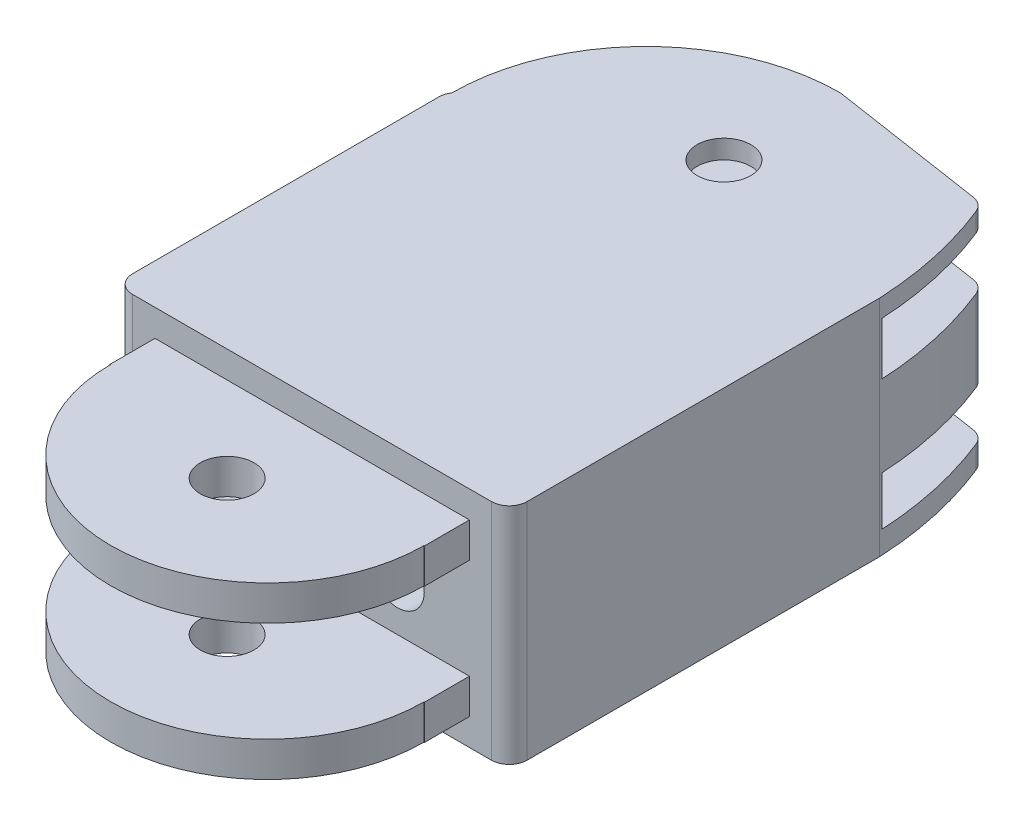
from build123d import *

# Parameters (mm, degrees)
SKETCH2_W             = 17.554431489
SKETCH2_H             = 1.95
BOSS_EXTRUDE1_DEPTH   = 8.75
BOSS_EXTRUDE1_2_DEPTH = 8.75
CUT_EXTRUDE1_DEPTH    = 26.518349076
SKETCH4_W             = 22.027215745
SKETCH4_H             = 12.505427167
BOSS_EXTRUDE2_DEPTH   = 32
SKETCH5_R             = 1.5
CUT_EXTRUDE2_DEPTH    = 12
SKETCH6_W             = 22.027215745
SKETCH6_H             = 12.505427167
SKETCH6_W_2           = 17.554431489
SKETCH6_H_2           = 1.95
CUT_EXTRUDE3_DEPTH    = 2.5
SKETCH7_R             = 1.5
CUT_EXTRUDE4_DEPTH    = 13
SKETCH8_R             = 1.5
CUT_EXTRUDE5_DEPTH    = 34
FILLET3_R             = 1
SKETCH9_W             = 22.010837792
SKETCH9_H             = 2.932484208
SKETCH9_H_2           = 2.729697333
CUT_EXTRUDE6_DEPTH    = 11
SKETCH10_W            = 18.490355351
SKETCH10_H            = 2.932484208
SKETCH10_H_2          = 2.729697333
CUT_EXTRUDE7_DEPTH    = 5


with BuildPart() as part:
    # Sketch2 → Boss-Extrude1 (new body)
    with BuildSketch(Plane.XY):
        with Locations((-13.228930986, -27.845183414)):
            Rectangle(SKETCH2_W, SKETCH2_H)
    extrude(amount=BOSS_EXTRUDE1_DEPTH)


with BuildPart() as body_2:
    # Sketch2 → Boss-Extrude1 2 (new body)
    with BuildSketch(Plane.XY):
        with Locations((-13.228930986, -20.289756247)):
            Rectangle(SKETCH2_W, SKETCH2_H)
    extrude(amount=BOSS_EXTRUDE1_2_DEPTH)


with BuildPart() as cut_extrude1_tool:
    # Sketch3 → Cut-Extrude1 (new, through all)
    with BuildSketch(Plane(origin=(0, -19.314756247, 0), x_dir=(1, 0, 0), z_dir=(0, 1, 0))):
        with BuildLine():
            ThreePointArc((-13.228930986, -8.75), (-7.041746651, -6.187184335), (-4.478930986, 0))
            add(Edge.make_bspline(
                [(-4.478930986, 0), (1.138349918, -4.151657709), (-4.451715242, -8.75)],
                knots=[0, 0, 0, 1, 1, 1], degree=2))
            add(Edge.make_bspline(
                [(-22.006146731, -8.75), (-13.228930986, -12.473510392), (-4.451715242, -8.75)],
                knots=[0, 0, 0, 1, 1, 1], degree=2))
            add(Edge.make_bspline(
                [(-21.978930986, 0), (-25.926969228, -4.242865138), (-22.006146731, -8.75)],
                knots=[0, 0, 0, 1, 1, 1], degree=2))
            ThreePointArc((-21.978930986, 0), (-19.416115322, -6.187184335), (-13.228930986, -8.75))
        make_face()
    extrude(amount=-CUT_EXTRUDE1_DEPTH)


with BuildPart() as part_1:
    add(part.part)

    # Cut-Extrude1: cut by cut_extrude1_tool
    add(cut_extrude1_tool.part, mode=Mode.SUBTRACT)



with BuildPart() as body_2_1:
    add(body_2.part)

    # Cut-Extrude1: cut by cut_extrude1_tool
    add(cut_extrude1_tool.part, mode=Mode.SUBTRACT)


with BuildPart() as part_2:
    add(part_1.part)

    add(body_2_1.part)  # Boss-Extrude2 merges body 2
    # Sketch4 → Boss-Extrude2 (add)
    with BuildSketch(Plane(origin=(0, 0, 0), x_dir=(-1, 0, 0), z_dir=(0, 0, -1))):
        with Locations((13.242538859, -24.067469831)):
            Rectangle(SKETCH4_W, SKETCH4_H)
    extrude(amount=BOSS_EXTRUDE2_DEPTH)

    # Sketch5 → Cut-Extrude2 (cut)
    with BuildSketch(Plane(origin=(0, -19.314756247, 0), x_dir=(1, 0, 0), z_dir=(0, 1, 0))):
        with Locations(Location((-13.228930986, -2.25, 0), (0, 0, 270))):
            Circle(SKETCH5_R)
    extrude(amount=-CUT_EXTRUDE2_DEPTH, mode=Mode.SUBTRACT)

    # Sketch6 → Cut-Extrude3 (cut)
    with BuildSketch(Plane.XY):
        with Locations((-13.242538859, -24.067469831)):
            Rectangle(SKETCH6_W, SKETCH6_H)
        with Locations((-13.228930986, -27.845183414)):
            Rectangle(SKETCH6_W_2, SKETCH6_H_2, mode=Mode.SUBTRACT)
        with Locations((-13.228930986, -20.289756247)):
            Rectangle(SKETCH6_W_2, SKETCH6_H_2, mode=Mode.SUBTRACT)
    extrude(amount=-CUT_EXTRUDE3_DEPTH, mode=Mode.SUBTRACT)

    # Sketch7 → Cut-Extrude4 (cut)
    with BuildSketch(Plane(origin=(0, -17.814756247, 0), x_dir=(1, 0, 0), z_dir=(0, 1, 0))):
        with Locations(Location((-13.242538859, 25.5, 0), (0, 0, 270))):
            Circle(SKETCH7_R)
        with BuildLine():
            Line((-24.086865874, 21.155672985), (-24.256146731, 21.155672985))
            add(Edge.make_bspline(
                [(-2.228930986, 21.155672985), (11.471530889, 27.189710441), (-11.765166974, 53.431279988), (-37.007876173, 21.523583672), (-24.256146731, 21.155672985)],
                knots=[0, 0, 0, 0, 0.52011282, 1, 1, 1, 1], degree=3))
            add(Edge.make_bspline(
                [(-3.948545621, 30.585343246), (-2.007113924, 26.093685314), (-2.228930986, 21.155672985)],
                knots=[0, 0, 0, 1, 1, 1], degree=2))
            Line((-3.948545621, 30.585343246), (-13.242538859, 32))
            ThreePointArc((-13.242538859, 32), (-20.910636028, 28.823770155), (-24.086865874, 21.155672985))
        make_face()
    extrude(amount=-CUT_EXTRUDE4_DEPTH, mode=Mode.SUBTRACT)

    # Sketch8 → Cut-Extrude5 (cut)
    with BuildSketch(Plane.XY.offset(-2.5)):
        with Locations((-18.011106811, -24.06746983)):
            Circle(SKETCH8_R)
        with Locations((-8.473970906, -24.06746983)):
            Circle(SKETCH8_R)
    extrude(amount=-CUT_EXTRUDE5_DEPTH, mode=Mode.SUBTRACT)

    # Fillet3
    # the kernel refuses this fillet: 1 mm, written as the material it takes off along each edge
    with BuildSketch(Plane(origin=(-24.256146731, -15.314756247, -2.5), x_dir=(1, 0, 0), z_dir=(0, -1, 0))) as fillet3_piece_1:
        with BuildLine():
            CenterArc((FILLET3_R, -FILLET3_R), FILLET3_R, 90, 90)
            Line((0, -FILLET3_R), (-FILLET3_R * 0.02, -FILLET3_R))
            Line((-FILLET3_R * 0.02, -FILLET3_R), (-FILLET3_R * 0.02, FILLET3_R * 0.02))
            Line((-FILLET3_R * 0.02, FILLET3_R * 0.02), (FILLET3_R, FILLET3_R * 0.02))
            Line((FILLET3_R, FILLET3_R * 0.02), (FILLET3_R, 0))
        make_face()
    extrude(amount=17.505427167, mode=Mode.SUBTRACT)
    with BuildSketch(Plane(origin=(-24.256146731, -16.423026869, -21.155672985), x_dir=(0, 0, 1), z_dir=(0, -1, 0))) as fillet3_piece_2:
        with BuildLine():
            CenterArc((0.556691751, -1), FILLET3_R, 90, 33.827317624)
            Line((0, -0.169280857), (-0.011133835, -0.152666474))
            ThreePointArc((-0.011133835, -0.152666474), (-0.02, -0.084640429), (-0.02, 0))
            Line((-0.02, 0), (0, 0.02))
            Line((0, 0.02), (0.556691751, 0.02))
            Line((0.556691751, 0.02), (0.556691751, 0))
        make_face()
    extrude(amount=15.288885922, mode=Mode.SUBTRACT)
    with BuildSketch(Plane(origin=(-2.228930986, -32.820183414, -2.5), x_dir=(0, 0, -1), z_dir=(0, 1, 0))) as fillet3_piece_3:
        with BuildLine():
            CenterArc((FILLET3_R, FILLET3_R), FILLET3_R, 180, 90)
            Line((0, FILLET3_R), (-FILLET3_R * 0.02, FILLET3_R))
            Line((-FILLET3_R * 0.02, FILLET3_R), (-FILLET3_R * 0.02, -FILLET3_R * 0.02))
            Line((-FILLET3_R * 0.02, -FILLET3_R * 0.02), (FILLET3_R, -FILLET3_R * 0.02))
            Line((FILLET3_R, -FILLET3_R * 0.02), (FILLET3_R, 0))
        make_face()
    extrude(amount=17.505427167, mode=Mode.SUBTRACT)
    with BuildSketch(Plane(origin=(-3.948545621, -16.375444783, -30.585343246), x_dir=(-0.9886132451058307, 0, -0.1504787413600958), z_dir=(0, -1, 0))) as fillet3_piece_4:
        with BuildLine():
            CenterArc((0.562435527, -1), FILLET3_R, 90, 59.471323616)
            Line((-0.298939504, -0.492030458), (-0.316167005, -0.481871067))
            ThreePointArc((-0.316167005, -0.481871067), (-0.168173949, -0.234650824), (-0.016955383, 0.010607308))
            Line((-0.016955383, 0.010607308), (0, 0.02))
            Line((0, 0.02), (0.562435527, 0.02))
            Line((0.562435527, 0.02), (0.562435527, 0))
        make_face()
    extrude(amount=15.384050094, mode=Mode.SUBTRACT)

    # Sketch9 → Cut-Extrude6 (cut)
    with BuildSketch(Plane.XY.offset(-32.5)):
        with Locations((-13.24253886, -20.332641731)):
            Rectangle(SKETCH9_W, SKETCH9_H)
        with Locations((-13.24253886, -27.700904501)):
            Rectangle(SKETCH9_W, SKETCH9_H_2)
    extrude(amount=CUT_EXTRUDE6_DEPTH, mode=Mode.SUBTRACT)

    # Sketch10 → Cut-Extrude7 (cut)
    with BuildSketch(Plane(origin=(0, 0, -21.5), x_dir=(-1, 0, 0), z_dir=(0, 0, -1))):
        with Locations((13.054523996, -20.332641731)):
            Rectangle(SKETCH10_W, SKETCH10_H)
        with Locations((13.054523996, -27.700904501)):
            Rectangle(SKETCH10_W, SKETCH10_H_2)
    extrude(amount=-CUT_EXTRUDE7_DEPTH, mode=Mode.SUBTRACT)


solid = part_2.part
